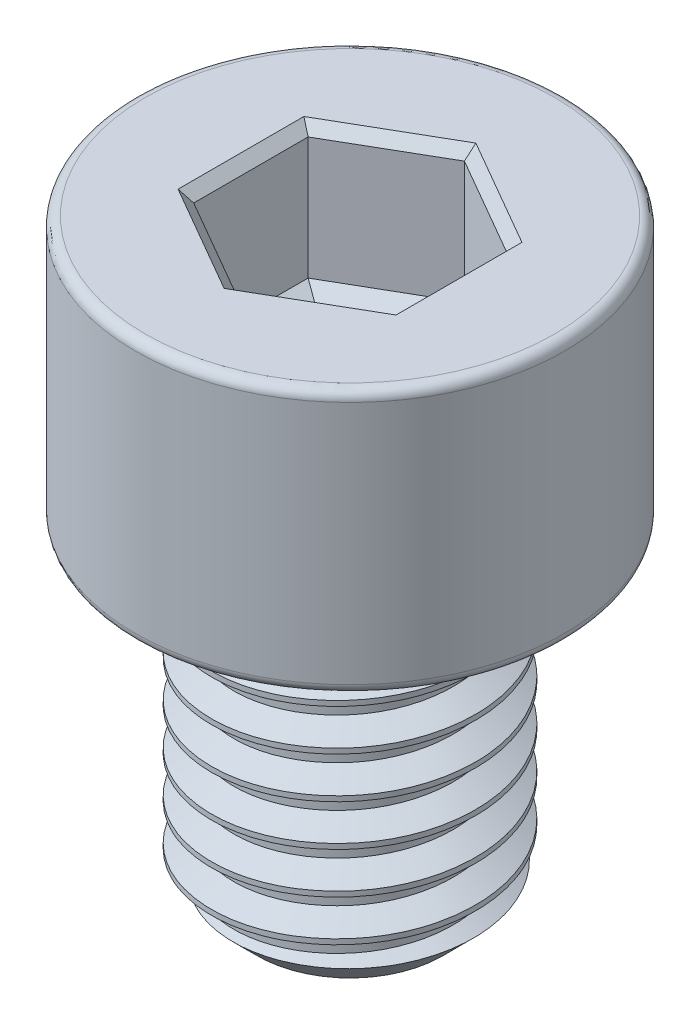
from build123d import *

# Parameters (mm, degrees)
SKETCH1_R           = 4
BOSS_EXTRUDE1_DEPTH = 10
THREAD1_PITCH       = 1.25
SKETCH2_R           = 6.5
BOSS_EXTRUDE2_DEPTH = 8
FILLET1_R           = 0.3
CUT_EXTRUDE1_DEPTH  = 4
CHAMFER1_SIZE       = 0.3
CUT_EXTRUDE2_DEPTH  = 0.4
CUT_EXTRUDE2_DRAFT  = -60


with BuildPart() as part:
    # Sketch1 → Boss-Extrude1 (new body)
    with BuildSketch(Plane(origin=(0, 0, 0), x_dir=(1, 0, 0), z_dir=(0, 1, 0))):
        with Locations(Location((0, 0, 0), (0, 0, 270))):
            Circle(SKETCH1_R)
    extrude(amount=BOSS_EXTRUDE1_DEPTH)

    # Thread1: the profile of Thread Profile1 profile screwed along a right-hand helix of 9 turns, 8 arcs to a turn; built about Z, then put on its axis
    thread1_z = Axis((0, 0, 0), (0, 0, 1))
    thread1_corners = [(4.0003, 0, -0.000173205), (4.0003, 0, 1.093923202), (3.323417656, 0, 0.703124998), (3.323417656, 0, 0.390624998)]
    with BuildLine(mode=Mode.PRIVATE) as thread1_profile:
        Line(thread1_corners[0], thread1_corners[1])
        Line(thread1_corners[1], thread1_corners[2])
        Line(thread1_corners[2], thread1_corners[3])
        Line(thread1_corners[3], thread1_corners[0])
    thread1_cap = Face(thread1_profile.wire())
    thread1_turn_angles = [0, 22.5, 45, 67.5, 90, 112.5, 135, 157.5, 180, 202.5, 225, 247.5, 270, 292.5, 315, 337.5, 360]
    thread1_turn_weights = [1, 0.9238795325112867, 1, 0.9238795325112867, 1, 0.9238795325112867, 1, 0.9238795325112867, 1, 0.9238795325112867, 1, 0.9238795325112867, 1, 0.9238795325112867, 1, 0.9238795325112867, 1]
    thread1_turn_rails = [Edge.make_bspline([Vector(p[0], p[1], 0).rotate(thread1_z, thread1_turn_angles[k]) / thread1_turn_weights[k] + Vector(0, 0, p[2] + THREAD1_PITCH * thread1_turn_angles[k] / 360) for k in range(17)], [0, 0, 0, 1, 1, 2, 2, 3, 3, 4, 4, 5, 5, 6, 6, 7, 7, 8, 8, 8], 2, thread1_turn_weights) for p in thread1_corners]
    thread1_turn_sides = [Face.make_surface_from_curves(thread1_turn_rails[p[0]], thread1_turn_rails[p[1]]) for p in [(0, 1), (1, 2), (2, 3), (3, 0)]]
    thread1 = Plane(origin=(0, 11.25, 0), x_dir=(-1, 0, 0), z_dir=(0, -1, 0)) * Solid(Shell([*[p.moved(Location((0, 0, THREAD1_PITCH * i))) for i in range(9) for p in thread1_turn_sides], thread1_cap, thread1_cap.rotate(thread1_z, 3240).moved(Location((0, 0, THREAD1_PITCH * 3240 / 360)))]))
    add(thread1, mode=Mode.SUBTRACT)

    # Sketch2 → Boss-Extrude2 (add)
    with BuildSketch(Plane(origin=(0, 10, 0), x_dir=(1, 0, 0), z_dir=(0, 1, 0))):
        with Locations(Location((0, 0, 0), (0, 0, 270))):
            Circle(SKETCH2_R)
    extrude(amount=BOSS_EXTRUDE2_DEPTH)

    # Sketch5 → Cut-Revolve1 (revolve, cut)
    with BuildSketch(Plane.XY, mode=Mode.PRIVATE) as cut_revolve1_sk:
        Polygon((4.01, 0), (4.01, 1.2), (2.81, 0), align=None)
    revolve(cut_revolve1_sk.sketch.rotate(Axis((0, 0, 0), (0, 1, 0)), 170.138426735), axis=Axis((0, 0, 0), (0, 1, 0)), mode=Mode.SUBTRACT)

    # Fillet1
    fillet1_edges = [part.edges().sort_by_distance(p)[0] for p in [
        (0, 10, -6.5),
        (0, 18, -6.5),
    ]]
    fillet(fillet1_edges, radius=FILLET1_R)

    # Sketch6 → Cut-Extrude1 (cut)
    with BuildSketch(Plane(origin=(0, 18, 0), x_dir=(1, 0, 0), z_dir=(0, 1, 0))):
        Polygon((0, 3.464101615), (-3, 1.732050808), (-3, -1.732050808), (0, -3.464101615), (3, -1.732050808), (3, 1.732050808), align=None)
    extrude(amount=-CUT_EXTRUDE1_DEPTH, mode=Mode.SUBTRACT)

    # Chamfer1
    chamfer1_edges = [part.edges().sort_by_distance(p)[0] for p in [
        (1.5, 18, -2.598076211),
        (-1.5, 18, -2.598076211),
        (-3, 18, 0),
        (-1.5, 18, 2.598076211),
        (1.5, 18, 2.598076211),
        (3, 18, 0),
    ]]
    chamfer(chamfer1_edges, length=CHAMFER1_SIZE)


with BuildPart() as cut_extrude2_tool:
    # Sketch7 → Cut-Extrude2 (with draft: the straight prism first)
    with BuildSketch(Plane(origin=(0, 14, 0), x_dir=(1, 0, 0), z_dir=(0, 1, 0))):
        Polygon((0, 3.464101615), (-3, 1.732050808), (-3, -1.732050808), (0, -3.464101615), (3, -1.732050808), (3, 1.732050808), align=None)
    extrude(amount=-CUT_EXTRUDE2_DEPTH)
    # Cut-Extrude2: the draft: its side faces are tilted about the plane it starts from
    cut_extrude2_sides = [cut_extrude2_tool.faces().sort_by_distance(p)[0] for p in [
        (-1.5, 13.8, -2.598076211),
        (-3, 13.8, 0),
        (-1.5, 13.8, 2.598076211),
        (1.5, 13.8, 2.598076211),
        (3, 13.8, 0),
        (1.5, 13.8, -2.598076211),
    ]]
    draft(cut_extrude2_sides, Plane(origin=(0, 14, 0), x_dir=(1, 0, 0), z_dir=(0, 1, 0)), CUT_EXTRUDE2_DRAFT)


with BuildPart() as part_1:
    add(part.part)

    # Cut-Extrude2: cut by cut_extrude2_tool
    add(cut_extrude2_tool.part, mode=Mode.SUBTRACT)


solid = part_1.part
